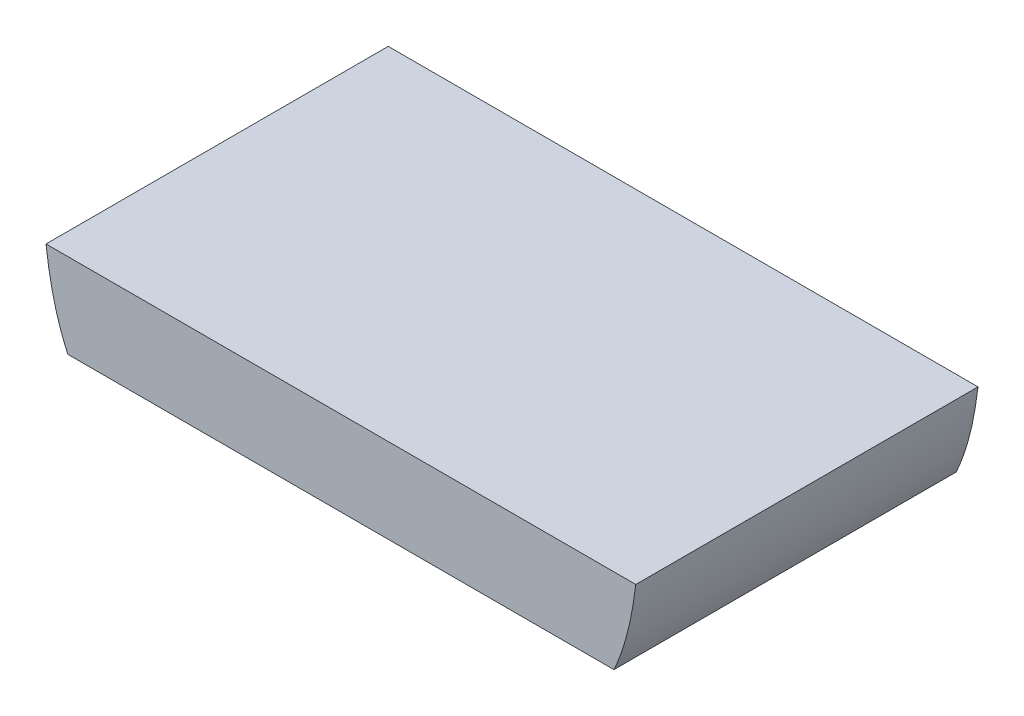
from build123d import *

# Parameters (mm, degrees)
BOSS_EXTRUDE1_DEPTH      = 203.2
BOSS_EXTRUDE1_DEPTH_BACK = 203.2
SPLIT1_SURFACE_1_BACK    = 840.808
SPLIT1_SURFACE_1_DEPTH   = 1681.616


with BuildPart() as part:
    # Sketch1 → Boss-Extrude1 (new, two sides: drawn at the far end of the back side and taken through both)
    with BuildSketch(Plane.XY.offset(-BOSS_EXTRUDE1_DEPTH_BACK)):
        with BuildLine():
            Line((-350.176916026, 222.758), (0, 222.758))
            Line((0, 222.758), (350.176916026, 222.758))
            add(Edge.make_bspline(
                [(350.176916026, 222.758), (323.602122165, 0), (0, 0)],
                knots=[0, 0, 0, 1, 1, 1], degree=2, weights=[1, 1.328097491, 1]))
            add(Edge.make_bspline(
                [(-350.176916026, 222.758), (-323.602122165, 0), (0, 0)],
                knots=[0, 0, 0, 1, 1, 1], degree=2, weights=[1, 1.328097491, 1]))
        make_face()
    extrude(amount=BOSS_EXTRUDE1_DEPTH + BOSS_EXTRUDE1_DEPTH_BACK)

    # Split1: cut with a surface, the side it looks to stays
    # Split1 surface: a surface, the sketch's curves swept straight by 1681.616 mm
    with BuildLine(Plane.XY.offset(-SPLIT1_SURFACE_1_BACK), mode=Mode.PRIVATE) as split1_surface_1_path:
        Line((-363.688822472, 122.174), (403.145628683, 122.174))
    split1_surface_1 = Shell.extrude(split1_surface_1_path.wire(), (0 * SPLIT1_SURFACE_1_DEPTH, 0 * SPLIT1_SURFACE_1_DEPTH, 1 * SPLIT1_SURFACE_1_DEPTH))
    split(bisect_by=split1_surface_1, keep=Keep.TOP)


solid = part.part
